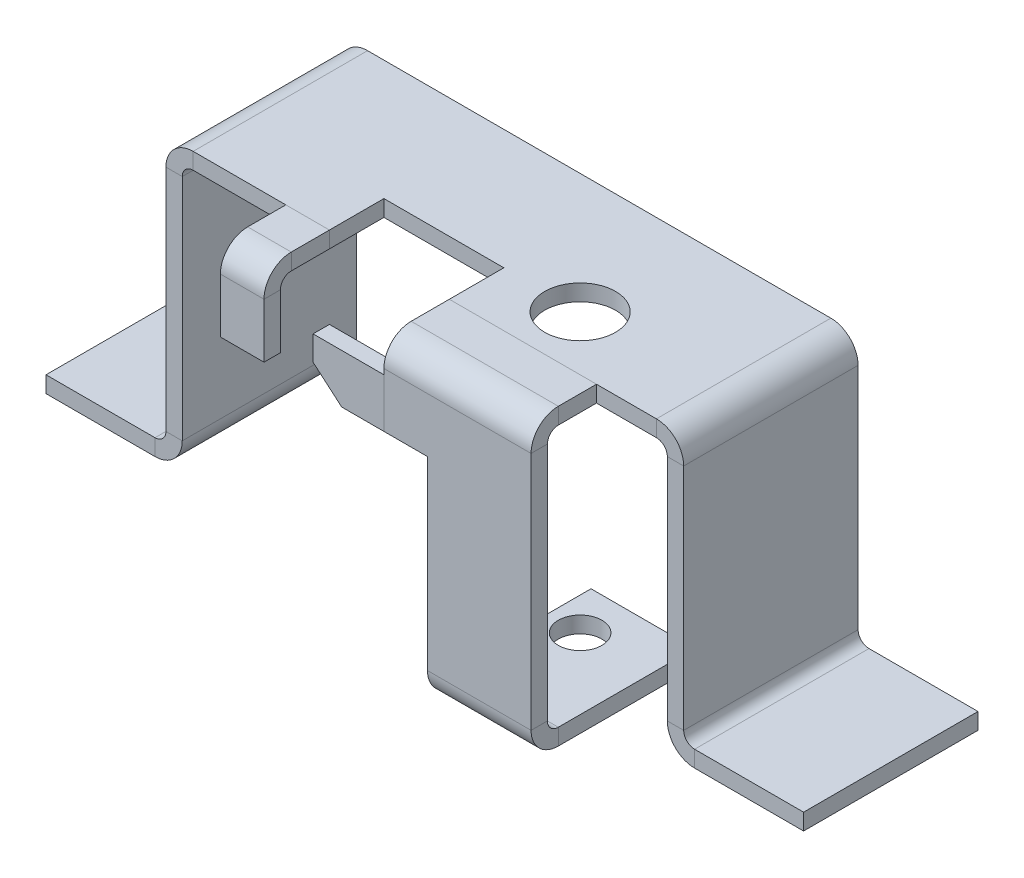
from build123d import *

# Parameters (mm, degrees)
BRIDA_BASE1_DEPTH     = 32
BRIDA_BASE2_DEPTH     = 8
CROQUIS9_W            = 22
CROQUIS9_H            = 10
CORTAR_EXTRUIR1_DEPTH = 10
CORTAR_EXTRUIR2_DEPTH = 3
BRIDA_BASE6_DEPTH     = 27
CROQUIS29_W           = 8
CROQUIS29_H           = 40
CORTAR_EXTRUIR7_DEPTH = 33
CROQUIS30_W           = 3
CROQUIS30_H           = 9
BRIDA_BASE7_DEPTH     = 13
CORTAR_EXTRUIR8_DEPTH = 3
CROQUIS34_R           = 4
CORTAR_EXTRUIR9_DEPTH = 3


# Sheet-metal steps are written as plain solids
with BuildPart() as part:
    # Croquis1 → Brida base1 (new body)
    with BuildSketch(Plane.XY):
        with BuildLine():
            Line((0, 0), (-20, 0))
            ThreePointArc((-20, 0), (-21.414213562, 0.585786438), (-22, 2))
            Line((-22, 2), (-22, 44))
            ThreePointArc((-22, 44), (-23.464466094, 47.535533906), (-27, 49))
            Line((-27, 49), (-112, 49))
            ThreePointArc((-112, 49), (-115.535533906, 47.535533906), (-117, 44))
            Line((-117, 44), (-117, 2))
            ThreePointArc((-117, 2), (-117.585786438, 0.585786438), (-119, 0))
            Line((-119, 0), (-139, 0))
            Line((-139, 0), (-139, -3))
            Line((-139, -3), (-119, -3))
            ThreePointArc((-119, -3), (-115.464466094, -1.535533906), (-114, 2))
            Line((-114, 2), (-114, 44))
            ThreePointArc((-114, 44), (-113.414213562, 45.414213562), (-112, 46))
            Line((-112, 46), (-27, 46))
            ThreePointArc((-27, 46), (-25.585786438, 45.414213562), (-25, 44))
            Line((-25, 44), (-25, 2))
            ThreePointArc((-25, 2), (-23.535533906, -1.535533906), (-20, -3))
            Line((-20, -3), (0, -3))
            Line((0, -3), (0, 0))
        make_face()
    extrude(amount=BRIDA_BASE1_DEPTH)

    # Croquis9 → Cortar-Extruir1 (cut)
    with BuildSketch(Plane(origin=(0, 49, 0), x_dir=(1, 0, 0), z_dir=(0, 1, 0))):
        with Locations((-76, -27)):
            Rectangle(CROQUIS9_W, CROQUIS9_H)
    extrude(amount=-CORTAR_EXTRUIR1_DEPTH, mode=Mode.SUBTRACT)

    # Croquis19 → Cortar-Extruir2 (cut)
    with BuildSketch(Plane(origin=(0, 49, 0), x_dir=(1, 0, 0), z_dir=(0, 1, 0))):
        with BuildLine():
            ThreePointArc((-51, -15.5), (-55.596194078, -26.596194078), (-44.5, -22))
            Line((-44.5, -22), (-51, -22))
            Line((-51, -22), (-51, -15.5))
        make_face()
        with BuildLine():
            Line((-51, -22), (-44.5, -22))
            ThreePointArc((-44.5, -22), (-46.403805922, -17.403805922), (-51, -15.5))
            Line((-51, -15.5), (-51, -22))
        make_face()
    extrude(amount=-CORTAR_EXTRUIR2_DEPTH, mode=Mode.SUBTRACT)


with BuildPart() as body_2:
    # Croquis6 → Brida base2 (new body)
    with BuildSketch(Plane(origin=(-95, 0, 0), x_dir=(0, 0, -1), z_dir=(1, 0, 0))):
        with BuildLine():
            Line((-32, 49), (-39, 49))
            ThreePointArc((-39, 49), (-42.535533906, 47.535533906), (-44, 44))
            Line((-44, 44), (-44, 34))
            Line((-44, 34), (-41, 34))
            Line((-41, 34), (-41, 44))
            ThreePointArc((-41, 44), (-40.414213562, 45.414213562), (-39, 46))
            Line((-39, 46), (-32, 46))
            Line((-32, 46), (-32, 49))
        make_face()
    extrude(amount=BRIDA_BASE2_DEPTH)


with BuildPart() as body_3:
    # Croquis26 → Brida base6 (new body)
    with BuildSketch(Plane(origin=(-65, 0, 0), x_dir=(0, 0, -1), z_dir=(1, 0, 0))):
        with BuildLine():
            Line((-32, 49), (-39, 49))
            ThreePointArc((-39, 49), (-42.535533906, 47.535533906), (-44, 44))
            Line((-44, 44), (-44, 0))
            ThreePointArc((-44, 0), (-42.535533906, -3.535533906), (-39, -5))
            Line((-39, -5), (-14, -5))
            Line((-14, -5), (-14, -2))
            Line((-14, -2), (-39, -2))
            ThreePointArc((-39, -2), (-40.414213562, -1.414213562), (-41, 0))
            Line((-41, 0), (-41, 44))
            ThreePointArc((-41, 44), (-40.414213562, 45.414213562), (-39, 46))
            Line((-39, 46), (-32, 46))
            Line((-32, 46), (-32, 49))
        make_face()
    extrude(amount=BRIDA_BASE6_DEPTH)

    # Croquis29 → Cortar-Extruir7 (cut)
    with BuildSketch(Plane.XY.offset(44)):
        with Locations((-61, 14)):
            Rectangle(CROQUIS29_W, CROQUIS29_H)
    extrude(amount=-CORTAR_EXTRUIR7_DEPTH, mode=Mode.SUBTRACT)

    # Croquis34 → Cortar-Extruir9 (cut)
    with BuildSketch(Plane(origin=(0, -2, 0), x_dir=(1, 0, 0), z_dir=(0, 1, 0))):
        with Locations(Location((-51, -22, 0), (0, 0, 270))):
            Circle(CROQUIS34_R)
    extrude(amount=-CORTAR_EXTRUIR9_DEPTH, mode=Mode.SUBTRACT)


with BuildPart() as body_4:
    # Croquis30 → Brida base7 (new body)
    with BuildSketch(Plane.ZY.offset(65)):
        with Locations((42.5, 38.5)):
            Rectangle(CROQUIS30_W, CROQUIS30_H)
    extrude(amount=BRIDA_BASE7_DEPTH)

    # Croquis33 → Cortar-Extruir8 (cut)
    with BuildSketch(Plane.XY.offset(44)):
        Polygon((-78, 38.5), (-72.745469491, 34), (-78, 34), align=None)
    extrude(amount=-CORTAR_EXTRUIR8_DEPTH, mode=Mode.SUBTRACT)


solid = Compound([part.part, body_2.part, body_3.part, body_4.part])
